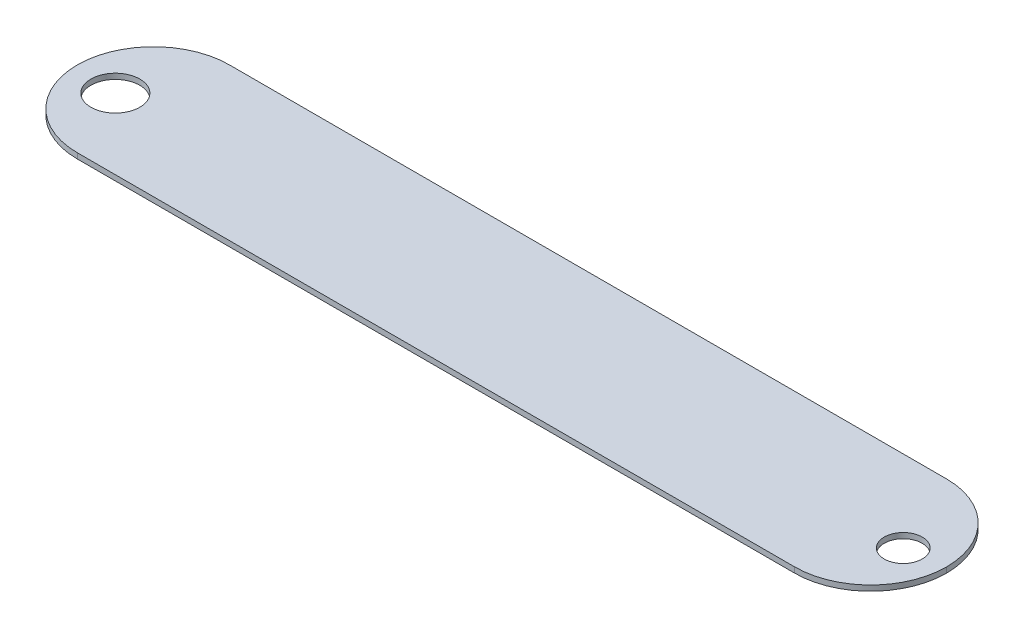
from build123d import *

# Parameters (mm, degrees)
SKETCH_1_W      = 80
SKETCH_1_H      = 14
SKETCH_1_R      = 2.25
SKETCH_1_R_2    = 1.75
EXTRUDE_1_DEPTH = 0.5
FILLET_1_R      = 7


with BuildPart() as part:
    # 草图1 → 凸台-拉伸1 (new body)
    with BuildSketch(Plane(origin=(0, 0, 0), x_dir=(1, 0, 0), z_dir=(0, 1, 0))):
        with Locations((40, -7)):
            Rectangle(SKETCH_1_W, SKETCH_1_H)
        with Locations(Location((4, -7.5, 0), (0, 0, 270))):
            Circle(SKETCH_1_R, mode=Mode.SUBTRACT)
        with Locations(Location((76.5, -7.5, 0), (0, 0, 270))):
            Circle(SKETCH_1_R_2, mode=Mode.SUBTRACT)
    extrude(amount=EXTRUDE_1_DEPTH)

    # 圆角1
    fillet_1_edges = [part.edges().sort_by_distance(p)[0] for p in [
        (0, 0.25, 0),
        (80, 0.25, 0),
        (80, 0.25, 14),
        (0, 0.25, 14),
    ]]
    fillet(fillet_1_edges, radius=FILLET_1_R - 0.0001)  # a hair under: the kernel refuses the full size


solid = part.part
